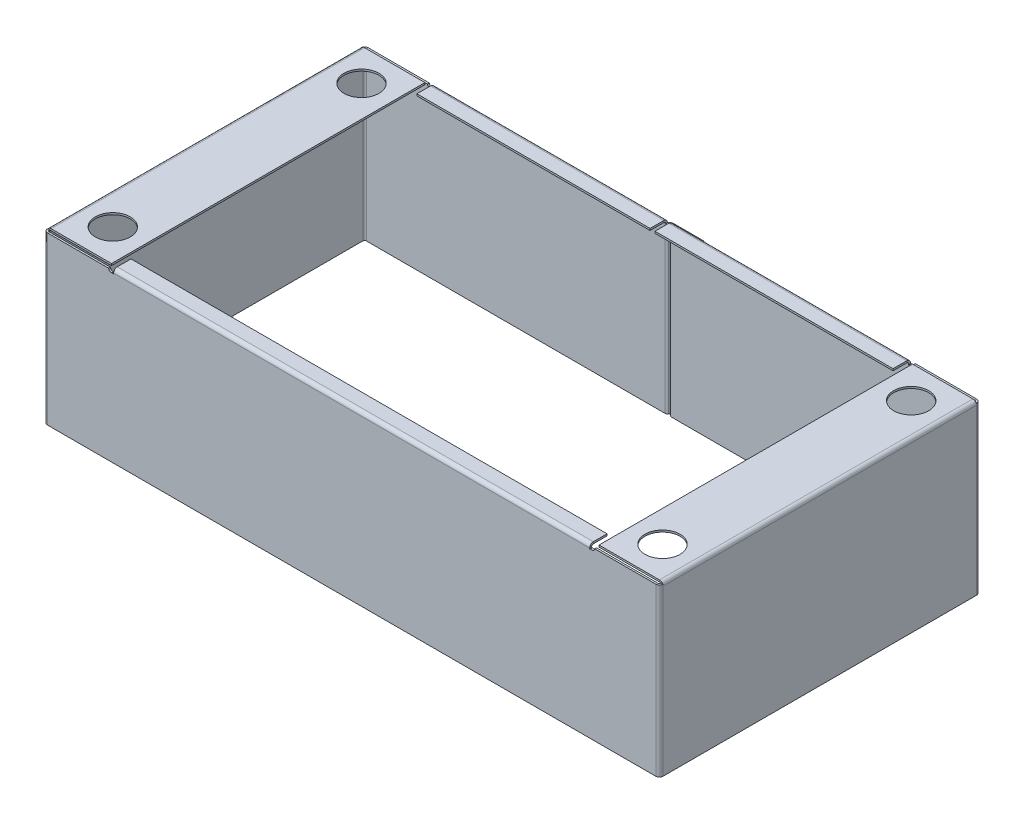
from build123d import *

# Parameters (mm, degrees)
BASE_FLANGE2_DEPTH              = 68
EDGE_FLANGE1_STRIP_W            = 4.4732
EDGE_FLANGE1_STRIP_H            = 0.75
EDGE_FLANGE1_STRIP_CUT_DEPTH    = 128.0668
EDGE_FLANGE1_STRIP_2_W          = 4.4732
EDGE_FLANGE1_STRIP_2_H          = 0.75
EDGE_FLANGE1_STRIP_CUT_2_DEPTH  = 128.0668
EDGE_FLANGE1_DEPTH              = 128.0668
EDGE_FLANGE1_BEND_DEPTH         = 128.0668
CUT_EXTRUDE2_REACH              = 293.159
SKETCH19_R                      = 1
EDGE_FLANGE2_STRIP_W            = 4.4732
EDGE_FLANGE2_STRIP_H            = 0.75
EDGE_FLANGE2_STRIP_CUT_DEPTH    = 194.5268
EDGE_FLANGE2_RELIEF_W           = 4.8482
EDGE_FLANGE2_RELIEF_H           = 0.375
EDGE_FLANGE2_RELIEF_CUT_DEPTH   = 0.75
EDGE_FLANGE2_STRIP_2_W          = 4.4732
EDGE_FLANGE2_STRIP_2_H          = 0.75
EDGE_FLANGE2_STRIP_CUT_2_DEPTH  = 95.2634
EDGE_FLANGE2_RELIEF_2_W         = 4.8482
EDGE_FLANGE2_RELIEF_2_H         = 0.375
EDGE_FLANGE2_RELIEF_CUT_2_DEPTH = 0.75
EDGE_FLANGE2_STRIP_3_W          = 4.4732
EDGE_FLANGE2_STRIP_3_H          = 0.75
EDGE_FLANGE2_STRIP_CUT_3_DEPTH  = 97.2634
EDGE_FLANGE2_RELIEF_3_W         = 4.8482
EDGE_FLANGE2_RELIEF_3_H         = 0.375
EDGE_FLANGE2_RELIEF_CUT_3_DEPTH = 0.75
EDGE_FLANGE2_DEPTH              = 194.5268
EDGE_FLANGE2_BEND_DEPTH         = 95.2634
EDGE_FLANGE2_BEND_2_DEPTH       = 97.2634
EDGE_FLANGE3_DEPTH              = 67.2634
EDGE_FLANGE3_2_DEPTH            = 67.2634
EDGE_FLANGE4_STRIP_CUT_DEPTH    = 67.2634
EDGE_FLANGE4_DEPTH              = 67.2634
CUT_EXTRUDE3_REACH              = 293.239
SKETCH36_R                      = 7.14375


# Read off the part's stored shape, not the designer's step: Edge-Flange3
# Sheet-metal steps are written as plain solids
with BuildPart() as part:
    # Sketch10 → Base-Flange2 (new body)
    with BuildSketch(Plane(origin=(0, 0, 0), x_dir=(1, 0, 0), z_dir=(0, 1, 0))):
        with BuildLine():
            Line((123, 129.54), (0.7366, 129.54))
            ThreePointArc((0.7366, 129.54), (0.215745145, 129.324254855), (0, 128.8034))
            Line((0, 128.8034), (0, 0.7366))
            ThreePointArc((0, 0.7366), (0.215745145, 0.215745145), (0.7366, 0))
            Line((0.7366, 0), (249.2634, 0))
            ThreePointArc((249.2634, 0), (249.784254855, 0.215745145), (250, 0.7366))
            Line((250, 0.7366), (250, 128.8034))
            ThreePointArc((250, 128.8034), (249.784254855, 129.324254855), (249.2634, 129.54))
            Line((249.2634, 129.54), (125, 129.54))
            Line((125, 129.54), (125, 130.29))
            Line((125, 130.29), (249.2634, 130.29))
            ThreePointArc((249.2634, 130.29), (250.314584941, 129.854584941), (250.75, 128.8034))
            Line((250.75, 128.8034), (250.75, 0.7366))
            ThreePointArc((250.75, 0.7366), (250.314584941, -0.314584941), (249.2634, -0.75))
            Line((249.2634, -0.75), (0.7366, -0.75))
            ThreePointArc((0.7366, -0.75), (-0.314584941, -0.314584941), (-0.75, 0.7366))
            Line((-0.75, 0.7366), (-0.75, 128.8034))
            ThreePointArc((-0.75, 128.8034), (-0.314584941, 129.854584941), (0.7366, 130.29))
            Line((0.7366, 130.29), (123, 130.29))
            Line((123, 130.29), (123, 129.54))
        make_face()
    extrude(amount=BASE_FLANGE2_DEPTH)

    # Edge-Flange1 strip (across the edge) → Edge-Flange1 strip cut (cut)
    with BuildSketch(Plane(origin=(0, 68, -128.8034), x_dir=(0, -1, 0), z_dir=(0, 0, 1))):
        with Locations((-1.5, -0.375)):
            Rectangle(EDGE_FLANGE1_STRIP_W, EDGE_FLANGE1_STRIP_H)
    extrude(amount=EDGE_FLANGE1_STRIP_CUT_DEPTH, mode=Mode.SUBTRACT)

    # Edge-Flange1 strip 2 (across the edge) → Edge-Flange1 strip cut 2 (cut)
    with BuildSketch(Plane(origin=(250, 68, -0.7366), x_dir=(0, -1, 0), z_dir=(0, 0, -1))):
        with Locations((-1.5, -0.375)):
            Rectangle(EDGE_FLANGE1_STRIP_2_W, EDGE_FLANGE1_STRIP_2_H)
    extrude(amount=EDGE_FLANGE1_STRIP_CUT_2_DEPTH, mode=Mode.SUBTRACT)

    # Edge-Flange1 section (across the edge) → Edge-Flange1 (add)
    with BuildSketch(Plane(origin=(0, 68, -128.8034), x_dir=(0, -1, 0), z_dir=(0, 0, 1))):
        with BuildLine():
            Line((-0.75, 0.7366), (-0.75, 25.4))
            Line((-0.75, 25.4), (0, 25.4))
            Line((0, 25.4), (0, 0.7366))
            ThreePointArc((0, 0.7366), (0.215745145, 0.215745145), (0.7366, 0))
            Line((0.7366, 0), (0.7366, -0.75))
            ThreePointArc((0.7366, -0.75), (-0.314584941, -0.314584941), (-0.75, 0.7366))
        make_face()
    extrude(amount=EDGE_FLANGE1_DEPTH)

    # Edge-Flange1 section 2 (across the edge) → Edge-Flange1 bend (add)
    with BuildSketch(Plane(origin=(250, 68, -0.7366), x_dir=(0, -1, 0), z_dir=(0, 0, -1))):
        with BuildLine():
            Line((-0.75, 0.7366), (-0.75, 25.4))
            Line((-0.75, 25.4), (0, 25.4))
            Line((0, 25.4), (0, 0.7366))
            ThreePointArc((0, 0.7366), (0.215745145, 0.215745145), (0.7366, 0))
            Line((0.7366, 0), (0.7366, -0.75))
            ThreePointArc((0.7366, -0.75), (-0.314584941, -0.314584941), (-0.75, 0.7366))
        make_face()
    extrude(amount=EDGE_FLANGE1_BEND_DEPTH)

    # Sketch19 → Cut-Extrude2 (cut, up to next)
    with BuildSketch(Plane.XY.offset(0.75), mode=Mode.PRIVATE) as cut_extrude2_sk1:
        with Locations((26.7366, 68)):
            Circle(SKETCH19_R)
    cut_extrude2_tool1 = extrude(cut_extrude2_sk1.sketch, amount=-CUT_EXTRUDE2_REACH, mode=Mode.PRIVATE) & part.part
    # Sketch19 → Cut-Extrude2 (cut, up to next)
    with BuildSketch(Plane.XY.offset(0.75), mode=Mode.PRIVATE) as cut_extrude2_sk2:
        with Locations((223.2634, 68)):
            Circle(SKETCH19_R)
    cut_extrude2_tool2 = extrude(cut_extrude2_sk2.sketch, amount=-CUT_EXTRUDE2_REACH, mode=Mode.PRIVATE) & part.part
    cut_extrude2_1 = cut_extrude2_tool1.solids().sort_by_distance((26.7366, 68, 0.75))[0]
    add(cut_extrude2_1, mode=Mode.SUBTRACT)
    cut_extrude2_2 = cut_extrude2_tool2.solids().sort_by_distance((223.2634, 68, 0.75))[0]
    add(cut_extrude2_2, mode=Mode.SUBTRACT)
    cut_extrude2 = cut_extrude2_1 + cut_extrude2_2  # Cut-Extrude2 as one shape, for the pattern or mirror that repeats it

    # Mirror1: Cut-Extrude2 across plane
    add(cut_extrude2.mirror(Plane.XY.offset(-64.77)), mode=Mode.SUBTRACT)

    # Edge-Flange2 strip (across the edge) → Edge-Flange2 strip cut (cut)
    with BuildSketch(Plane(origin=(27.7366, 68, 0), x_dir=(0, -1, 0), z_dir=(1, 0, 0))):
        with Locations((-1.5, -0.375)):
            Rectangle(EDGE_FLANGE2_STRIP_W, EDGE_FLANGE2_STRIP_H)
    extrude(amount=EDGE_FLANGE2_STRIP_CUT_DEPTH, mode=Mode.SUBTRACT)

    # Edge-Flange2 relief (on the sheet) → Edge-Flange2 relief cut (cut)
    with BuildSketch(Plane(origin=(27.7366, 67.2634, 0), x_dir=(0, -1, 0), z_dir=(0, 0, -1))):
        with Locations((-2.0491, 0.1875)):
            Rectangle(EDGE_FLANGE2_RELIEF_W, EDGE_FLANGE2_RELIEF_H)
        with Locations((-2.0491, -194.7143)):
            Rectangle(EDGE_FLANGE2_RELIEF_W, EDGE_FLANGE2_RELIEF_H)
    extrude(amount=-EDGE_FLANGE2_RELIEF_CUT_DEPTH, mode=Mode.SUBTRACT)

    # Edge-Flange2 strip 2 (across the edge) → Edge-Flange2 strip cut 2 (cut)
    with BuildSketch(Plane(origin=(123, 68, -129.54), x_dir=(0, -1, 0), z_dir=(-1, 0, 0))):
        with Locations((-1.5, -0.375)):
            Rectangle(EDGE_FLANGE2_STRIP_2_W, EDGE_FLANGE2_STRIP_2_H)
    extrude(amount=EDGE_FLANGE2_STRIP_CUT_2_DEPTH, mode=Mode.SUBTRACT)

    # Edge-Flange2 relief 2 (on the sheet) → Edge-Flange2 relief cut 2 (cut)
    with BuildSketch(Plane(origin=(123, 67.2634, -129.54), x_dir=(0, -1, 0), z_dir=(0, 0, 1))):
        with Locations((-2.0491, -95.4509)):
            Rectangle(EDGE_FLANGE2_RELIEF_2_W, EDGE_FLANGE2_RELIEF_2_H)
    extrude(amount=-EDGE_FLANGE2_RELIEF_CUT_2_DEPTH, mode=Mode.SUBTRACT)

    # Edge-Flange2 strip 3 (across the edge) → Edge-Flange2 strip cut 3 (cut)
    with BuildSketch(Plane(origin=(222.2634, 68, -129.54), x_dir=(0, -1, 0), z_dir=(-1, 0, 0))):
        with Locations((-1.5, -0.375)):
            Rectangle(EDGE_FLANGE2_STRIP_3_W, EDGE_FLANGE2_STRIP_3_H)
    extrude(amount=EDGE_FLANGE2_STRIP_CUT_3_DEPTH, mode=Mode.SUBTRACT)

    # Edge-Flange2 relief 3 (on the sheet) → Edge-Flange2 relief cut 3 (cut)
    with BuildSketch(Plane(origin=(222.2634, 67.2634, -129.54), x_dir=(0, -1, 0), z_dir=(0, 0, 1))):
        with Locations((-2.0491, 0.1875)):
            Rectangle(EDGE_FLANGE2_RELIEF_3_W, EDGE_FLANGE2_RELIEF_3_H)
    extrude(amount=-EDGE_FLANGE2_RELIEF_CUT_3_DEPTH, mode=Mode.SUBTRACT)

    # Edge-Flange2 section (across the edge) → Edge-Flange2 (add)
    with BuildSketch(Plane(origin=(27.7366, 68, 0), x_dir=(0, -1, 0), z_dir=(1, 0, 0))):
        with BuildLine():
            Line((-0.75, 0.7366), (-0.75, 6.35))
            Line((-0.75, 6.35), (0, 6.35))
            Line((0, 6.35), (0, 0.7366))
            ThreePointArc((0, 0.7366), (0.215745145, 0.215745145), (0.7366, 0))
            Line((0.7366, 0), (0.7366, -0.75))
            ThreePointArc((0.7366, -0.75), (-0.314584941, -0.314584941), (-0.75, 0.7366))
        make_face()
    extrude(amount=EDGE_FLANGE2_DEPTH)

    # Edge-Flange2 section 2 (across the edge) → Edge-Flange2 bend (add)
    with BuildSketch(Plane(origin=(123, 68, -129.54), x_dir=(0, -1, 0), z_dir=(-1, 0, 0))):
        with BuildLine():
            Line((-0.75, 0.7366), (-0.75, 6.35))
            Line((-0.75, 6.35), (0, 6.35))
            Line((0, 6.35), (0, 0.7366))
            ThreePointArc((0, 0.7366), (0.215745145, 0.215745145), (0.7366, 0))
            Line((0.7366, 0), (0.7366, -0.75))
            ThreePointArc((0.7366, -0.75), (-0.314584941, -0.314584941), (-0.75, 0.7366))
        make_face()
    extrude(amount=EDGE_FLANGE2_BEND_DEPTH)

    # Edge-Flange2 section 3 (across the edge) → Edge-Flange2 bend 2 (add)
    with BuildSketch(Plane(origin=(222.2634, 68, -129.54), x_dir=(0, -1, 0), z_dir=(-1, 0, 0))):
        with BuildLine():
            Line((-0.75, 0.7366), (-0.75, 6.35))
            Line((-0.75, 6.35), (0, 6.35))
            Line((0, 6.35), (0, 0.7366))
            ThreePointArc((0, 0.7366), (0.215745145, 0.215745145), (0.7366, 0))
            Line((0.7366, 0), (0.7366, -0.75))
            ThreePointArc((0.7366, -0.75), (-0.314584941, -0.314584941), (-0.75, 0.7366))
        make_face()
    extrude(amount=EDGE_FLANGE2_BEND_2_DEPTH)

    # Edge-Flange3 outline → Edge-Flange3 (cut)
    with BuildSketch(Plane(origin=(0, 0, 0), x_dir=(1, 0, 0), z_dir=(0, 1, 0))):
        with BuildLine():
            Line((123, 129.54), (123, 129.571647209))
            ThreePointArc((123, 129.571647209), (122.848263594, 129.547932969), (122.69489029, 129.54))
            Line((122.69489029, 129.54), (123, 129.54))
        make_face()
    extrude(amount=EDGE_FLANGE3_DEPTH, mode=Mode.SUBTRACT)

    # Edge-Flange3 2 outline → Edge-Flange3 2 (add)
    with BuildSketch(Plane(origin=(0, 0, 0), x_dir=(1, 0, 0), z_dir=(0, 1, 0))):
        with BuildLine():
            ThreePointArc((123, 129.571647209), (123.402450121, 129.719183216), (123.746075231, 129.975415059))
            Line((123.746075231, 129.975415059), (124.237436867, 130.466776695))
            Line((124.237436867, 130.466776695), (123.707106781, 130.997106781))
            Line((123.707106781, 130.997106781), (123.215745145, 130.505745145))
            ThreePointArc((123.215745145, 130.505745145), (122.976774906, 130.346070336), (122.69489029, 130.29))
            Line((122.69489029, 130.29), (123, 130.29))
            Line((123, 130.29), (123, 129.571647209))
        make_face()
    extrude(amount=EDGE_FLANGE3_2_DEPTH)

    # Edge-Flange4 strip (across the edge) → Edge-Flange4 strip cut (cut)
    with BuildSketch(Plane(origin=(124.237436867, 0, -130.466776695), x_dir=(0, 0, 1), z_dir=(0, 1, 0))):
        Polygon((-3.477614995, 2.416954823), (-0.314584941, -0.746075231), (0.215745145, -0.215745145), (-2.947284909, 2.947284909), align=None)
    extrude(amount=EDGE_FLANGE4_STRIP_CUT_DEPTH, mode=Mode.SUBTRACT)

    # Edge-Flange4 section (across the edge) → Edge-Flange4 (add)
    with BuildSketch(Plane(origin=(124.237436867, 0, -130.466776695), x_dir=(0, 0, 1), z_dir=(0, 1, 0))):
        with BuildLine():
            Line((-0.75, 0.30510971), (-0.75, 12.7))
            Line((-0.75, 12.7), (0, 12.7))
            Line((0, 12.7), (0, 0.30510971))
            ThreePointArc((0, 0.30510971), (0.056070336, 0.023225094), (0.215745145, -0.215745145))
            Line((0.215745145, -0.215745145), (-0.314584941, -0.746075231))
            ThreePointArc((-0.314584941, -0.746075231), (-0.636839313, -0.263787481), (-0.75, 0.30510971))
        make_face()
    extrude(amount=EDGE_FLANGE4_DEPTH)

    # Sketch36 → Cut-Extrude3 (cut, up to next)
    with BuildSketch(Plane(origin=(0, 68.75, 0), x_dir=(1, 0, 0), z_dir=(0, 1, 0)), mode=Mode.PRIVATE) as cut_extrude3_sk1:
        with Locations(Location((12.7, 115.57, 0), (0, 0, 180))):
            Circle(SKETCH36_R)
    cut_extrude3_tool1 = extrude(cut_extrude3_sk1.sketch, amount=-CUT_EXTRUDE3_REACH, mode=Mode.PRIVATE) & part.part
    # Sketch36 → Cut-Extrude3 (cut, up to next)
    with BuildSketch(Plane(origin=(0, 68.75, 0), x_dir=(1, 0, 0), z_dir=(0, 1, 0)), mode=Mode.PRIVATE) as cut_extrude3_sk2:
        with Locations(Location((237.3, 115.57, 0), (0, 0, 180))):
            Circle(SKETCH36_R)
    cut_extrude3_tool2 = extrude(cut_extrude3_sk2.sketch, amount=-CUT_EXTRUDE3_REACH, mode=Mode.PRIVATE) & part.part
    # Sketch36 → Cut-Extrude3 (cut, up to next)
    with BuildSketch(Plane(origin=(0, 68.75, 0), x_dir=(1, 0, 0), z_dir=(0, 1, 0)), mode=Mode.PRIVATE) as cut_extrude3_sk3:
        with Locations(Location((237.3, 13.97, 0), (0, 0, 180))):
            Circle(SKETCH36_R)
    cut_extrude3_tool3 = extrude(cut_extrude3_sk3.sketch, amount=-CUT_EXTRUDE3_REACH, mode=Mode.PRIVATE) & part.part
    # Sketch36 → Cut-Extrude3 (cut, up to next)
    with BuildSketch(Plane(origin=(0, 68.75, 0), x_dir=(1, 0, 0), z_dir=(0, 1, 0)), mode=Mode.PRIVATE) as cut_extrude3_sk4:
        with Locations(Location((12.7, 13.97, 0), (0, 0, 180))):
            Circle(SKETCH36_R)
    cut_extrude3_tool4 = extrude(cut_extrude3_sk4.sketch, amount=-CUT_EXTRUDE3_REACH, mode=Mode.PRIVATE) & part.part
    add(cut_extrude3_tool1.solids().sort_by_distance((12.7, 68.75, -115.57))[0], mode=Mode.SUBTRACT)
    add(cut_extrude3_tool2.solids().sort_by_distance((237.3, 68.75, -115.57))[0], mode=Mode.SUBTRACT)
    add(cut_extrude3_tool3.solids().sort_by_distance((237.3, 68.75, -13.97))[0], mode=Mode.SUBTRACT)
    add(cut_extrude3_tool4.solids().sort_by_distance((12.7, 68.75, -13.97))[0], mode=Mode.SUBTRACT)


solid = part.part
